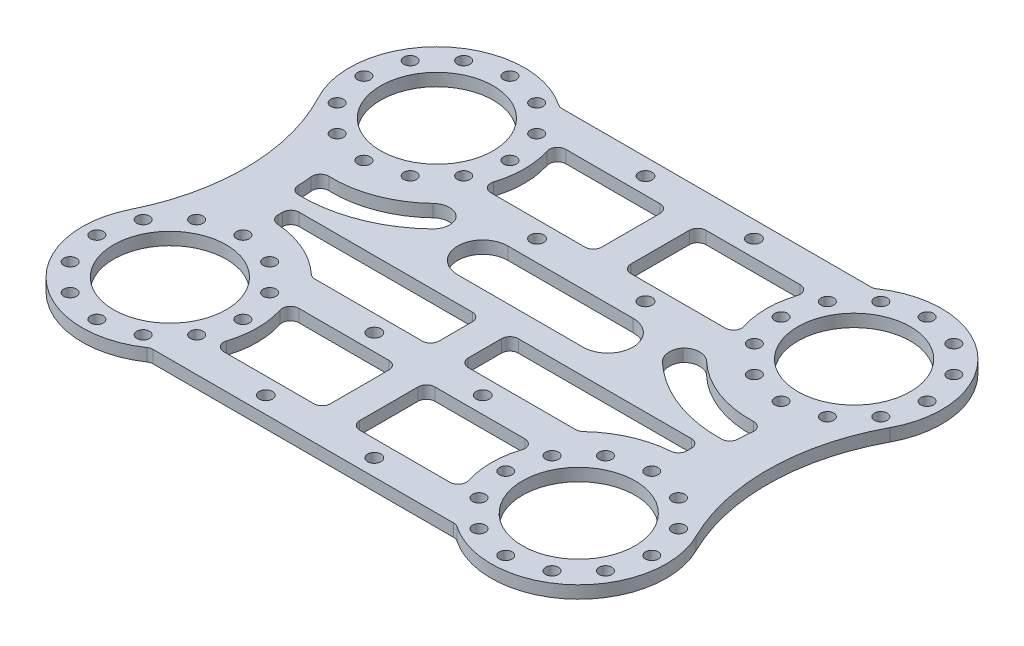
from build123d import *

# Parameters (mm, degrees)
SKETCH_1_R          = 1.525
SKETCH_1_R_2        = 1.6
SKETCH_1_R_3        = 13.5
EXTRUDE_1_DEPTH     = 3
SKETCH_2_R          = 5
CUT_EXTRUDE_3_DEPTH = 10
CUT_EXTRUDE_START   = -10
CUT_EXTRUDE_4_DEPTH = 10
CUT_EXTRUDE_5_DEPTH = 10
FILLET_1_R          = 2
FILLET_2_R          = 4
SKETCH_7_W          = 7
SKETCH_7_H          = 12
SKETCH_7_H_2        = 18
EXTRUDE_1_2_DEPTH   = 3
FILLET_3_R          = 2


with BuildPart() as part:
    # 草图1 → Extrude 1 (new body)
    with BuildSketch(Plane(origin=(0, 0, 0), x_dir=(1, 0, 0), z_dir=(0, 1, 0))):
        with BuildLine():
            Line((50, 21), (-50, 21))
            ThreePointArc((-50, 21), (-68.012459283, 10.795893227), (-68.520055922, -9.899875183))
            ThreePointArc((-68.520055922, -9.899875183), (-62.621343275, -32.70186682), (-67.81583057, -55.674523071))
            ThreePointArc((-67.81583057, -55.674523071), (-66.844256997, -76.071697803), (-49, -86))
            Line((-49, -86), (49, -86))
            ThreePointArc((49, -86), (66.844256997, -76.071697803), (67.81583057, -55.674523071))
            ThreePointArc((67.81583057, -55.674523071), (62.621343275, -32.70186682), (68.520055922, -9.899875183))
            ThreePointArc((68.520055922, -9.899875183), (68.012459283, 10.795893227), (50, 21))
        make_face()
        with Locations(Location((-58.75, -15.155444566, 0), (0, 0, 270))):
            Circle(SKETCH_1_R, mode=Mode.SUBTRACT)
        with Locations(Location((-65.155444566, -8.75, 0), (0, 0, 270))):
            Circle(SKETCH_1_R, mode=Mode.SUBTRACT)
        with Locations(Location((-50, -17.5, 0), (0, 0, 270))):
            Circle(SKETCH_1_R, mode=Mode.SUBTRACT)
        with Locations(Location((-41.25, -15.155444566, 0), (0, 0, 270))):
            Circle(SKETCH_1_R, mode=Mode.SUBTRACT)
        with Locations(Location((-34.844555434, -8.75, 0), (0, 0, 270))):
            Circle(SKETCH_1_R, mode=Mode.SUBTRACT)
        with Locations(Location((-13, -13, 0), (0, 0, 270))):
            Circle(SKETCH_1_R_2, mode=Mode.SUBTRACT)
        with Locations(Location((-67.5, 0, 0), (0, 0, 270))):
            Circle(SKETCH_1_R, mode=Mode.SUBTRACT)
        with Locations(Location((-50, 0, 0), (0, 0, 270))):
            Circle(SKETCH_1_R_3, mode=Mode.SUBTRACT)
        with Locations(Location((-65.155444566, 8.75, 0), (0, 0, 270))):
            Circle(SKETCH_1_R, mode=Mode.SUBTRACT)
        with Locations(Location((-58.75, 15.155444566, 0), (0, 0, 270))):
            Circle(SKETCH_1_R, mode=Mode.SUBTRACT)
        with Locations(Location((-50, 17.5, 0), (0, 0, 270))):
            Circle(SKETCH_1_R, mode=Mode.SUBTRACT)
        with Locations(Location((-41.25, 15.155444566, 0), (0, 0, 270))):
            Circle(SKETCH_1_R, mode=Mode.SUBTRACT)
        with Locations(Location((-32.5, 0, 0), (0, 0, 270))):
            Circle(SKETCH_1_R, mode=Mode.SUBTRACT)
        with Locations(Location((-34.844555434, 8.75, 0), (0, 0, 270))):
            Circle(SKETCH_1_R, mode=Mode.SUBTRACT)
        with Locations(Location((-13, 13, 0), (0, 0, 270))):
            Circle(SKETCH_1_R_2, mode=Mode.SUBTRACT)
        with Locations(Location((13, -13, 0), (0, 0, 270))):
            Circle(SKETCH_1_R_2, mode=Mode.SUBTRACT)
        with Locations(Location((34.844555434, -8.75, 0), (0, 0, 270))):
            Circle(SKETCH_1_R, mode=Mode.SUBTRACT)
        with Locations(Location((41.25, -15.155444566, 0), (0, 0, 270))):
            Circle(SKETCH_1_R, mode=Mode.SUBTRACT)
        with Locations(Location((50, -17.5, 0), (0, 0, 270))):
            Circle(SKETCH_1_R, mode=Mode.SUBTRACT)
        with Locations(Location((58.75, -15.155444566, 0), (0, 0, 270))):
            Circle(SKETCH_1_R, mode=Mode.SUBTRACT)
        with Locations(Location((65.155444566, -8.75, 0), (0, 0, 270))):
            Circle(SKETCH_1_R, mode=Mode.SUBTRACT)
        with Locations(Location((32.5, 0, 0), (0, 0, 270))):
            Circle(SKETCH_1_R, mode=Mode.SUBTRACT)
        with Locations(Location((13, 13, 0), (0, 0, 270))):
            Circle(SKETCH_1_R_2, mode=Mode.SUBTRACT)
        with Locations(Location((34.844555434, 8.75, 0), (0, 0, 270))):
            Circle(SKETCH_1_R, mode=Mode.SUBTRACT)
        with Locations(Location((50, 0, 0), (0, 0, 270))):
            Circle(SKETCH_1_R_3, mode=Mode.SUBTRACT)
        with Locations(Location((67.5, 0, 0), (0, 0, 270))):
            Circle(SKETCH_1_R, mode=Mode.SUBTRACT)
        with Locations(Location((41.25, 15.155444566, 0), (0, 0, 270))):
            Circle(SKETCH_1_R, mode=Mode.SUBTRACT)
        with Locations(Location((50, 17.5, 0), (0, 0, 270))):
            Circle(SKETCH_1_R, mode=Mode.SUBTRACT)
        with Locations(Location((65.155444566, 8.75, 0), (0, 0, 270))):
            Circle(SKETCH_1_R, mode=Mode.SUBTRACT)
        with Locations(Location((58.75, 15.155444566, 0), (0, 0, 270))):
            Circle(SKETCH_1_R, mode=Mode.SUBTRACT)
        with Locations(Location((57.75, -49.844555434, 0), (0, 0, 270))):
            Circle(SKETCH_1_R, mode=Mode.SUBTRACT)
        with Locations(Location((64.155444566, -56.25, 0), (0, 0, 270))):
            Circle(SKETCH_1_R, mode=Mode.SUBTRACT)
        with Locations(Location((49, -47.5, 0), (0, 0, 270))):
            Circle(SKETCH_1_R, mode=Mode.SUBTRACT)
        with Locations(Location((-57.75, -80.155444566, 0), (0, 0, 270))):
            Circle(SKETCH_1_R, mode=Mode.SUBTRACT)
        with Locations(Location((-64.155444566, -73.75, 0), (0, 0, 270))):
            Circle(SKETCH_1_R, mode=Mode.SUBTRACT)
        with Locations(Location((-49, -82.5, 0), (0, 0, 270))):
            Circle(SKETCH_1_R, mode=Mode.SUBTRACT)
        with Locations(Location((-40.25, -80.155444566, 0), (0, 0, 270))):
            Circle(SKETCH_1_R, mode=Mode.SUBTRACT)
        with Locations(Location((-66.5, -65, 0), (0, 0, 270))):
            Circle(SKETCH_1_R, mode=Mode.SUBTRACT)
        with Locations(Location((-49, -65, 0), (0, 0, 270))):
            Circle(SKETCH_1_R_3, mode=Mode.SUBTRACT)
        with Locations(Location((-33.844555434, -73.75, 0), (0, 0, 270))):
            Circle(SKETCH_1_R, mode=Mode.SUBTRACT)
        with Locations(Location((-13, -78, 0), (0, 0, 270))):
            Circle(SKETCH_1_R_2, mode=Mode.SUBTRACT)
        with Locations(Location((-31.5, -65, 0), (0, 0, 270))):
            Circle(SKETCH_1_R, mode=Mode.SUBTRACT)
        with Locations(Location((-64.155444566, -56.25, 0), (0, 0, 270))):
            Circle(SKETCH_1_R, mode=Mode.SUBTRACT)
        with Locations(Location((-57.75, -49.844555434, 0), (0, 0, 270))):
            Circle(SKETCH_1_R, mode=Mode.SUBTRACT)
        with Locations(Location((-49, -47.5, 0), (0, 0, 270))):
            Circle(SKETCH_1_R, mode=Mode.SUBTRACT)
        with Locations(Location((-40.25, -49.844555434, 0), (0, 0, 270))):
            Circle(SKETCH_1_R, mode=Mode.SUBTRACT)
        with Locations(Location((-33.844555434, -56.25, 0), (0, 0, 270))):
            Circle(SKETCH_1_R, mode=Mode.SUBTRACT)
        with Locations(Location((-13, -52, 0), (0, 0, 270))):
            Circle(SKETCH_1_R_2, mode=Mode.SUBTRACT)
        with Locations(Location((13, -78, 0), (0, 0, 270))):
            Circle(SKETCH_1_R_2, mode=Mode.SUBTRACT)
        with Locations(Location((33.844555434, -73.75, 0), (0, 0, 270))):
            Circle(SKETCH_1_R, mode=Mode.SUBTRACT)
        with Locations(Location((31.5, -65, 0), (0, 0, 270))):
            Circle(SKETCH_1_R, mode=Mode.SUBTRACT)
        with Locations(Location((40.25, -80.155444566, 0), (0, 0, 270))):
            Circle(SKETCH_1_R, mode=Mode.SUBTRACT)
        with Locations(Location((49, -82.5, 0), (0, 0, 270))):
            Circle(SKETCH_1_R, mode=Mode.SUBTRACT)
        with Locations(Location((57.75, -80.155444566, 0), (0, 0, 270))):
            Circle(SKETCH_1_R, mode=Mode.SUBTRACT)
        with Locations(Location((64.155444566, -73.75, 0), (0, 0, 270))):
            Circle(SKETCH_1_R, mode=Mode.SUBTRACT)
        with Locations(Location((49, -65, 0), (0, 0, 270))):
            Circle(SKETCH_1_R_3, mode=Mode.SUBTRACT)
        with Locations(Location((66.5, -65, 0), (0, 0, 270))):
            Circle(SKETCH_1_R, mode=Mode.SUBTRACT)
        with Locations(Location((13, -52, 0), (0, 0, 270))):
            Circle(SKETCH_1_R_2, mode=Mode.SUBTRACT)
        with Locations(Location((33.844555434, -56.25, 0), (0, 0, 270))):
            Circle(SKETCH_1_R, mode=Mode.SUBTRACT)
        with Locations(Location((40.25, -49.844555434, 0), (0, 0, 270))):
            Circle(SKETCH_1_R, mode=Mode.SUBTRACT)
    extrude(amount=EXTRUDE_1_DEPTH)

    # 草图2 → 切除-拉伸3 (cut)
    with BuildSketch(Plane(origin=(0, 0, 0), x_dir=(1, 0, 0), z_dir=(0, 1, 0))):
        with Locations(Location((0, 0, 0), (0, 0, 270))):
            Circle(SKETCH_2_R)
    extrude(amount=CUT_EXTRUDE_3_DEPTH, mode=Mode.SUBTRACT)

    # 草图5 → 切除-拉伸4 (cut)
    with BuildSketch(Plane(origin=(0, 3, 0), x_dir=(1, 0, 0), z_dir=(0, 1, 0)).offset(CUT_EXTRUDE_START)):
        with BuildLine():
            Line((31.026334039, 9), (-31.026334039, 9))
            ThreePointArc((-31.026334039, 9), (-29, 0), (-31.026334039, -9))
            Line((-31.026334039, -9), (31.026334039, -9))
            ThreePointArc((31.026334039, -9), (29, 0), (31.026334039, 9))
        make_face()
        with BuildLine():
            Line((-37.671171994, 17), (37.671171994, 17))
            ThreePointArc((37.671171994, 17), (43.519259302, 19.974984355), (50, 21))
            Line((50, 21), (-50, 21))
            ThreePointArc((-50, 21), (-43.519259302, 19.974984355), (-37.671171994, 17))
        make_face()
        with BuildLine():
            Line((-36.671171994, -82), (36.671171994, -82))
            ThreePointArc((36.671171994, -82), (42.519259302, -84.974984355), (49, -86))
            Line((49, -86), (-49, -86))
            ThreePointArc((-49, -86), (-42.519259302, -84.974984355), (-36.671171994, -82))
        make_face()
        with BuildLine():
            Line((-30.026334039, -74), (30.026334039, -74))
            ThreePointArc((30.026334039, -74), (28, -65), (30.026334039, -56))
            Line((30.026334039, -56), (-30.026334039, -56))
            ThreePointArc((-30.026334039, -56), (-28, -65), (-30.026334039, -74))
        make_face()
    extrude(amount=CUT_EXTRUDE_4_DEPTH, mode=Mode.SUBTRACT)

    # 草图6 → 切除-拉伸5 (cut)
    with BuildSketch(Plane(origin=(0, 3, 0), x_dir=(1, 0, 0), z_dir=(0, 1, 0))):
        with BuildLine():
            Line((-32.058925654, -48), (32.058925654, -48))
            ThreePointArc((32.058925654, -48), (39.83484861, -42.818926987), (49, -41))
            Line((49, -41), (49, -36))
            Line((49, -36), (-49, -36))
            Line((-49, -36), (-49, -41))
            ThreePointArc((-49, -41), (-39.83484861, -42.818926987), (-32.058925654, -48))
        make_face()
        with BuildLine():
            Line((-15, -18), (15, -18))
            ThreePointArc((15, -18), (21, -24), (15, -30))
            Line((15, -30), (-15, -30))
            ThreePointArc((-15, -30), (-21, -24), (-15, -18))
        make_face()
        with BuildLine():
            ThreePointArc((24.874297891, -20.614293427), (37.301238324, -29.916407737), (52.625097566, -32.393809019))
            ThreePointArc((52.625097566, -32.393809019), (52.815016675, -28.581128736), (53.247004528, -24.788242406))
            ThreePointArc((53.247004528, -24.788242406), (40.231721788, -23.012621336), (29.913271783, -14.883660488))
            ThreePointArc((29.913271783, -14.883660488), (27.484981665, -17.82916678), (24.874297891, -20.614293427))
        make_face()
        with BuildLine():
            ThreePointArc((-52.625097566, -32.393809019), (-52.815016675, -28.581128736), (-53.247004528, -24.788242406))
            ThreePointArc((-53.247004528, -24.788242406), (-40.231721788, -23.012621336), (-29.913271783, -14.883660488))
            ThreePointArc((-29.913271783, -14.883660488), (-27.484981665, -17.82916678), (-24.874297891, -20.614293427))
            ThreePointArc((-24.874297891, -20.614293427), (-37.301238324, -29.916407737), (-52.625097566, -32.393809019))
        make_face()
    extrude(amount=-CUT_EXTRUDE_5_DEPTH, mode=Mode.SUBTRACT)

    # 圆角1
    fillet_1_edges = [part.edges().sort_by_distance(p)[0] for p in [
        (-30.026334039, 1.5, 74),
        (-30.026334039, 1.5, 56),
        (30.026334039, 1.5, 56),
        (30.026334039, 1.5, 74),
        (31.026334039, 1.5, -9),
        (31.026334039, 1.5, 9),
        (-31.026334039, 1.5, 9),
        (-31.026334039, 1.5, -9),
        (-52.625097566, 1.5, 32.393809019),
        (-53.247004528, 1.5, 24.788242406),
        (-32.058925654, 1.5, 48),
        (-49, 1.5, 41),
        (-49, 1.5, 36),
        (49, 1.5, 36),
        (49, 1.5, 41),
        (32.058925654, 1.5, 48),
        (53.247004528, 1.5, 24.788242406),
        (52.625097566, 1.5, 32.393809019),
    ]]
    fillet(fillet_1_edges, radius=FILLET_1_R)

    # 圆角2
    # the kernel refuses this fillet: 4 mm, written as the material it adds along each edge
    with BuildSketch(Plane(origin=(24.874297891, 3, 20.614293427), x_dir=(0.6804565395356079, 0, 0.7327884400038156), z_dir=(0, -1, 0))) as fillet_2_piece_1:
        with BuildLine():
            CenterArc((3.737014637, -3.992486747), FILLET_2_R, 86.487715969, 87.914557456)
            ThreePointArc((-0.243910448, -3.602313106), (-0.094852481, -1.802991664), (0, 0))
            ThreePointArc((0, 0), (1.991032388, 0.061045177), (3.982064777, 0))
        make_face()
    extrude(amount=3)
    with BuildSketch(Plane(origin=(29.913271783, 3, 14.883660488), x_dir=(-0.6404459138418563, 0, 0.7680032756722263), z_dir=(0, -1, 0))) as fillet_2_piece_2:
        with BuildLine():
            CenterArc((4.642705935, -3.997195333), FILLET_2_R, 92.145722943, 91.605479772)
            ThreePointArc((0.651275735, -4.258891636), (0.417553865, -2.115389893), (0, 0))
            ThreePointArc((0, 0), (2.246470614, -0.042070001), (4.492941228, 0))
        make_face()
    extrude(amount=3)
    with BuildSketch(Plane(origin=(-24.874297891, 3, 20.614293427), x_dir=(-0.6804565395356054, 0, 0.7327884400038179), z_dir=(0, -1, 0))) as fillet_2_piece_3:
        with BuildLine():
            CenterArc((3.737014637, 3.992486747), FILLET_2_R, 185.597726575, 87.914557456)
            ThreePointArc((-0.243910448, 3.602313106), (-0.094852481, 1.802991664), (0, 0))
            ThreePointArc((0, 0), (1.991032388, -0.061045177), (3.982064777, 0))
        make_face()
    extrude(amount=3)
    with BuildSketch(Plane(origin=(-29.913271783, 3, 14.883660488), x_dir=(0.6404459138418604, 0, 0.7680032756722229), z_dir=(0, -1, 0))) as fillet_2_piece_4:
        with BuildLine():
            CenterArc((4.642705935, 3.997195333), FILLET_2_R, 176.248797285, 91.605479772)
            ThreePointArc((0.651275735, 4.258891636), (0.417553865, 2.115389893), (0, 0))
            ThreePointArc((0, 0), (2.246470614, 0.042070001), (4.492941228, 0))
        make_face()
    extrude(amount=3)

    # 草图7 → Extrude 1 2 (add)
    with BuildSketch(Plane(origin=(0, 3, 0), x_dir=(1, 0, 0), z_dir=(0, 1, 0))):
        with Locations((0, -42)):
            Rectangle(SKETCH_7_W, SKETCH_7_H)
        with Locations((0, -65)):
            Rectangle(SKETCH_7_W, SKETCH_7_H_2)
        Rectangle(SKETCH_7_W, SKETCH_7_H_2)
    extrude(amount=-EXTRUDE_1_2_DEPTH)

    # 圆角3
    fillet_3_edges = [part.edges().sort_by_distance(p)[0] for p in [
        (-37.671171994, 1.5, -17),
        (37.671171994, 1.5, -17),
        (-36.671171994, 1.5, 82),
        (36.671171994, 1.5, 82),
        (-3.5, 1.5, 48),
        (-3.5, 1.5, 36),
        (3.5, 1.5, 36),
        (3.5, 1.5, 48),
        (-3.5, 1.5, 74),
        (-3.5, 1.5, 56),
        (3.5, 1.5, 56),
        (3.5, 1.5, 74),
        (-3.5, 1.5, 9),
        (-3.5, 1.5, -9),
        (3.5, 1.5, -9),
        (3.5, 1.5, 9),
    ]]
    fillet(fillet_3_edges, radius=FILLET_3_R)


solid = part.part
